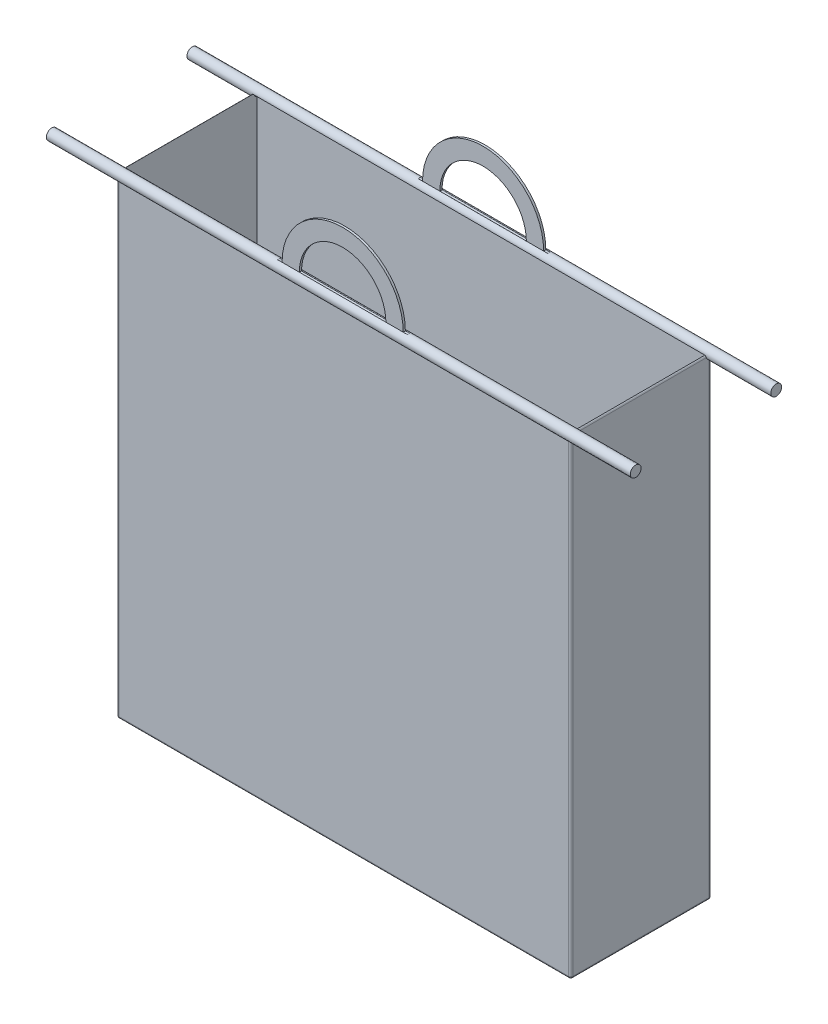
from build123d import *
from build123d.topology import SkipClean

# Parameters (mm, degrees)
SALIENTE_EXTRUIR3_DEPTH        = 342.9
SALIENTE_EXTRUIR3_DEPTH_BACK   = 342.9
CROQUIS3_R                     = 6.35
SALIENTE_EXTRUIR3_2_DEPTH      = 342.9
SALIENTE_EXTRUIR3_2_DEPTH_BACK = 342.9
CROQUIS4_W                     = 533.4
CROQUIS4_H                     = 165.1
SALIENTE_EXTRUIR4_DEPTH        = 555.498
VACIADO3_START                 = -265.43
VACIADO3_DEPTH                 = 530.86
VACIADO3_START_2               = -341.63
VACIADO3_2_OUTLINE_R           = 5.08
VACIADO3_2_DEPTH               = 683.26
REDONDEO5_R                    = 2.54
CROQUIS5_W                     = 152.4
CROQUIS5_H                     = 2.54
SALIENTE_EXTRUIR5_DEPTH        = 101.6
CORTAR_EXTRUIR2_DEPTH          = 676.270787465
CORTAR_EXTRUIR8_DEPTH          = 676.270787542


# Read off the part's stored shape, not the designer's step: Vaciado3
with BuildPart() as part:
    # Croquis3 → Saliente-Extruir3 (new, two sides: drawn at the far end of the back side and taken through both)
    with BuildSketch(Plane(origin=(0, 0, 0), x_dir=(0, 0, -1), z_dir=(1, 0, 0)).offset(-SALIENTE_EXTRUIR3_DEPTH_BACK)):
        Circle(CROQUIS3_R)
    extrude(amount=SALIENTE_EXTRUIR3_DEPTH + SALIENTE_EXTRUIR3_DEPTH_BACK)



with BuildPart() as body_2:
    # Croquis3 → Saliente-Extruir3 2 (new, two sides: drawn at the far end of the back side and taken through both)
    with BuildSketch(Plane(origin=(0, 0, 0), x_dir=(0, 0, -1), z_dir=(1, 0, 0)).offset(-SALIENTE_EXTRUIR3_2_DEPTH_BACK)):
        with Locations((165.1, 0)):
            Circle(CROQUIS3_R)
    extrude(amount=SALIENTE_EXTRUIR3_2_DEPTH + SALIENTE_EXTRUIR3_2_DEPTH_BACK)


with BuildPart() as part_1:
    add(part.part)

    add(body_2.part)  # Saliente-Extruir4 merges body 2
    # Croquis4 → Saliente-Extruir4 (add)
    with BuildSketch(Plane(origin=(0, 0, 0), x_dir=(1, 0, 0), z_dir=(0, 1, 0))):
        with Locations((0, 82.55)):
            Rectangle(CROQUIS4_W, CROQUIS4_H)
    extrude(amount=-SALIENTE_EXTRUIR4_DEPTH)

    # Vaciado3 outline → Vaciado3 (cut)
    with BuildSketch(Plane.YZ.offset(VACIADO3_START)):
        with BuildLine():
            Line((-554.228, -163.83), (-4.91868885, -163.83))
            ThreePointArc((-4.91868885, -163.83), (3.110851973, -169.116092628), (0, -160.02))
            Line((0, -160.02), (0, -5.08))
            ThreePointArc((0, -5.08), (3.110851973, 4.016092628), (-4.91868885, -1.27))
            Line((-4.91868885, -1.27), (-554.228, -1.27))
            Line((-554.228, -1.27), (-554.228, -163.83))
        make_face()
    extrude(amount=VACIADO3_DEPTH, mode=Mode.SUBTRACT)

    # Vaciado3 2 outline → Vaciado3 2 (cut)
    with BuildSketch(Plane.YZ.offset(VACIADO3_START_2)):
        with Locations((0, -165.1)):
            Circle(VACIADO3_2_OUTLINE_R)
        Circle(VACIADO3_2_OUTLINE_R)
    extrude(amount=VACIADO3_2_DEPTH, mode=Mode.SUBTRACT)

    # Redondeo5
    # the kernel refuses this fillet: 2.54 mm, written as the material it takes off along each edge
    with BuildSketch(Plane(origin=(-264.16, -552.958, -2.54), x_dir=(0, 0, 1), z_dir=(-1, 0, 0))) as redondeo5_piece_1_section:
        Polygon((0, 0), (REDONDEO5_R * 1.02, 0), (REDONDEO5_R * 1.02, -REDONDEO5_R * 1.02), (0, -REDONDEO5_R * 1.02), align=None)
    redondeo5_piece_1 = extrude(amount=REDONDEO5_R * 1.02, mode=Mode.PRIVATE)
    redondeo5_piece_1 = redondeo5_piece_1 - Plane(origin=(-264.16, -552.958, -2.54), x_dir=(0, 0.7071067811865475, -0.7071067811865475), z_dir=(-1, 0, 0)) * Sphere(REDONDEO5_R, mode=Mode.PRIVATE)
    add(redondeo5_piece_1, mode=Mode.SUBTRACT)
    with BuildSketch(Plane(origin=(-264.16, -552.958, -162.56), x_dir=(0, -1, 0), z_dir=(-1, 0, 0))) as redondeo5_piece_2_section:
        Polygon((0, 0), (REDONDEO5_R * 1.02, 0), (REDONDEO5_R * 1.02, -REDONDEO5_R * 1.02), (0, -REDONDEO5_R * 1.02), align=None)
    redondeo5_piece_2 = extrude(amount=REDONDEO5_R * 1.02, mode=Mode.PRIVATE)
    redondeo5_piece_2 = redondeo5_piece_2 - Plane(origin=(-264.16, -552.958, -162.56), x_dir=(0, 0.7071067811865475, 0.7071067811865475), z_dir=(-1, 0, 0)) * Sphere(REDONDEO5_R, mode=Mode.PRIVATE)
    add(redondeo5_piece_2, mode=Mode.SUBTRACT)
    with BuildSketch(Plane(origin=(264.16, -552.958, -2.54), x_dir=(1, 0, 0), z_dir=(0, 0, 1))) as redondeo5_piece_3_section:
        Polygon((0, 0), (REDONDEO5_R * 1.02, 0), (REDONDEO5_R * 1.02, -REDONDEO5_R * 1.02), (0, -REDONDEO5_R * 1.02), align=None)
    redondeo5_piece_3 = extrude(amount=REDONDEO5_R * 1.02, mode=Mode.PRIVATE)
    redondeo5_piece_3 = redondeo5_piece_3 - Plane(origin=(264.16, -552.958, -2.54), x_dir=(-0.7071067811865475, 0.7071067811865475, 0), z_dir=(0, 0, 1)) * Sphere(REDONDEO5_R, mode=Mode.PRIVATE)
    add(redondeo5_piece_3, mode=Mode.SUBTRACT)
    with BuildSketch(Plane(origin=(264.16, -552.958, -162.56), x_dir=(1, 0, 0), z_dir=(0, -1, 0))) as redondeo5_piece_4_section:
        Polygon((0, 0), (REDONDEO5_R * 1.02, 0), (REDONDEO5_R * 1.02, -REDONDEO5_R * 1.02), (0, -REDONDEO5_R * 1.02), align=None)
    redondeo5_piece_4 = extrude(amount=REDONDEO5_R * 1.02, mode=Mode.PRIVATE)
    redondeo5_piece_4 = redondeo5_piece_4 - Plane(origin=(264.16, -552.958, -162.56), x_dir=(-0.7071067811865474, 0, 0.7071067811865477), z_dir=(0, -1, 0)) * Sphere(REDONDEO5_R, mode=Mode.PRIVATE)
    add(redondeo5_piece_4, mode=Mode.SUBTRACT)
    with BuildSketch(Plane(origin=(266.7, 0, -164.249261314), x_dir=(0, -1, 0), z_dir=(0, 0, 1))) as redondeo5_piece_5_section:
        with BuildLine():
            CenterArc((2.199704526, -2.54), REDONDEO5_R, 90, 60)
            Line((0, -1.27), (0, 0))
            Line((0, 0), (2.199704526, 0))
        make_face()
    redondeo5_piece_5 = extrude(amount=163.398522628, mode=Mode.PRIVATE)
    redondeo5_piece_5 = redondeo5_piece_5 - Plane(origin=(266.364103935, 0, 0), x_dir=(0, 0, -1), z_dir=(-1, 0, 0)) * Cylinder(6.35, 336, mode=Mode.PRIVATE)
    redondeo5_piece_5 = redondeo5_piece_5 - Plane(origin=(266.364103935, 0, -165.1), x_dir=(0, 0, -1), z_dir=(-1, 0, 0)) * Cylinder(6.35, 336, mode=Mode.PRIVATE)
    add(redondeo5_piece_5, mode=Mode.SUBTRACT)
    with BuildSketch(Plane(origin=(-266.7, 0, -0.850738686), x_dir=(1, 0, 0), z_dir=(0, 0, -1))) as redondeo5_piece_6_section:
        with BuildLine():
            CenterArc((2.54, 2.199704526), REDONDEO5_R, 180, 60)
            Line((0, 2.199704526), (0, 0))
            Line((0, 0), (1.27, 0))
        make_face()
    redondeo5_piece_6 = extrude(amount=163.398522628, mode=Mode.PRIVATE)
    redondeo5_piece_6 = redondeo5_piece_6 - Plane(origin=(-266.364103935, 0, 0), x_dir=(0, 0, -1), z_dir=(-1, 0, 0)) * Cylinder(6.35, 336, mode=Mode.PRIVATE)
    redondeo5_piece_6 = redondeo5_piece_6 - Plane(origin=(-266.364103935, 0, -165.1), x_dir=(0, 0, -1), z_dir=(-1, 0, 0)) * Cylinder(6.35, 336, mode=Mode.PRIVATE)
    add(redondeo5_piece_6, mode=Mode.SUBTRACT)
    with BuildSketch(Plane(origin=(-266.7, 0, 0), x_dir=(1, 0, 0), z_dir=(0, -1, 0))) as redondeo5_piece_7_section:
        with BuildLine():
            CenterArc((REDONDEO5_R, -REDONDEO5_R), REDONDEO5_R, 90, 90)
            Line((0, -REDONDEO5_R), (0, 0))
            Line((0, 0), (REDONDEO5_R, 0))
        make_face()
    redondeo5_piece_7 = extrude(amount=552.958, mode=Mode.PRIVATE)
    redondeo5_piece_7 = redondeo5_piece_7 - Plane(origin=(-266.132673367, 0, 0), x_dir=(0, 0, -1), z_dir=(-1, 0, 0)) * Cylinder(6.35, 1117, mode=Mode.PRIVATE)
    add(redondeo5_piece_7, mode=Mode.SUBTRACT)
    with BuildSketch(Plane(origin=(-266.7, -555.498, -2.54), x_dir=(0, 1, 0), z_dir=(0, 0, -1)), Plane(origin=(266.7, -555.498, -162.56), x_dir=(0, 1, 0), z_dir=(0, 0, 1))) as redondeo5_piece_8:
        with BuildLine():
            CenterArc((REDONDEO5_R, REDONDEO5_R), REDONDEO5_R, 180, 90)
            Line((0, REDONDEO5_R), (0, 0))
            Line((0, 0), (REDONDEO5_R, 0))
        make_face()
    extrude(amount=160.02, mode=Mode.SUBTRACT)
    with BuildSketch(Plane(origin=(-266.7, 0, -165.1), x_dir=(0, 0, 1), z_dir=(0, -1, 0))) as redondeo5_piece_9_section:
        with BuildLine():
            CenterArc((REDONDEO5_R, -REDONDEO5_R), REDONDEO5_R, 90, 90)
            Line((0, -REDONDEO5_R), (0, 0))
            Line((0, 0), (REDONDEO5_R, 0))
        make_face()
    redondeo5_piece_9 = extrude(amount=552.958, mode=Mode.PRIVATE)
    redondeo5_piece_9 = redondeo5_piece_9 - Plane(origin=(-266.132672665, 0, -165.1), x_dir=(0, 0, -1), z_dir=(-1, 0, 0)) * Cylinder(6.35, 1117, mode=Mode.PRIVATE)
    add(redondeo5_piece_9, mode=Mode.SUBTRACT)
    with BuildSketch(Plane(origin=(266.7, 0, 0), x_dir=(-1, 0, 0), z_dir=(0, -1, 0))) as redondeo5_piece_10_section:
        with BuildLine():
            CenterArc((REDONDEO5_R, REDONDEO5_R), REDONDEO5_R, 180, 90)
            Line((0, REDONDEO5_R), (0, 0))
            Line((0, 0), (REDONDEO5_R, 0))
        make_face()
    redondeo5_piece_10 = extrude(amount=552.958, mode=Mode.PRIVATE)
    redondeo5_piece_10 = redondeo5_piece_10 - Plane(origin=(266.132673367, 0, 0), x_dir=(0, 0, -1), z_dir=(-1, 0, 0)) * Cylinder(6.35, 1117, mode=Mode.PRIVATE)
    add(redondeo5_piece_10, mode=Mode.SUBTRACT)
    with BuildSketch(Plane(origin=(264.16, -555.498, 0), x_dir=(0, 1, 0), z_dir=(-1, 0, 0))) as redondeo5_piece_11:
        with BuildLine():
            CenterArc((REDONDEO5_R, REDONDEO5_R), REDONDEO5_R, 180, 90)
            Line((0, REDONDEO5_R), (0, 0))
            Line((0, 0), (REDONDEO5_R, 0))
        make_face()
    extrude(amount=528.32, mode=Mode.SUBTRACT)
    with BuildSketch(Plane(origin=(-264.16, -555.498, -165.1), x_dir=(0, 0, 1), z_dir=(1, 0, 0))) as redondeo5_piece_12:
        with BuildLine():
            CenterArc((REDONDEO5_R, -REDONDEO5_R), REDONDEO5_R, 90, 90)
            Line((0, -REDONDEO5_R), (0, 0))
            Line((0, 0), (REDONDEO5_R, 0))
        make_face()
    extrude(amount=528.32, mode=Mode.SUBTRACT)
    with BuildSketch(Plane(origin=(266.7, 0, -165.1), x_dir=(0, 0, 1), z_dir=(0, -1, 0))) as redondeo5_piece_13_section:
        with BuildLine():
            CenterArc((REDONDEO5_R, REDONDEO5_R), REDONDEO5_R, 180, 90)
            Line((0, REDONDEO5_R), (0, 0))
            Line((0, 0), (REDONDEO5_R, 0))
        make_face()
    redondeo5_piece_13 = extrude(amount=552.958, mode=Mode.PRIVATE)
    redondeo5_piece_13 = redondeo5_piece_13 - Plane(origin=(266.132672665, 0, -165.1), x_dir=(0, 0, -1), z_dir=(-1, 0, 0)) * Cylinder(6.35, 1117, mode=Mode.PRIVATE)
    add(redondeo5_piece_13, mode=Mode.SUBTRACT)

    # Croquis5 → Saliente-Extruir5 (add)
    with SkipClean():  # the faces are left unmerged after this step: merging them gives an invalid solid
        with BuildSketch(Plane(origin=(0, 0, 0), x_dir=(1, 0, 0), z_dir=(0, 1, 0))):
            with Locations((0, 164.974335694)):
                Rectangle(CROQUIS5_W, CROQUIS5_H)
            Rectangle(CROQUIS5_W, CROQUIS5_H)
        extrude(amount=SALIENTE_EXTRUIR5_DEPTH)

    # Croquis6 → Cortar-Extruir2 (cut, through all)
    with SkipClean():  # the faces are left unmerged after this step: merging them gives an invalid solid
        with BuildSketch(Plane.XY.offset(1.27)):
            with BuildLine():
                Line((-50.8, 6.221703947), (50.8, 6.221703947))
                ThreePointArc((50.8, 6.221703947), (0, 57.021703947), (-50.8, 6.221703947))
            make_face()
        extrude(amount=-CORTAR_EXTRUIR2_DEPTH, mode=Mode.SUBTRACT)

    # Croquis7 → Cortar-Extruir8 (cut, through all)
    with SkipClean():  # the faces are left unmerged after this step: merging them gives an invalid solid
        with BuildSketch(Plane.XY.offset(1.27)):
            with BuildLine():
                Line((-71.12, 6.221703947), (-76.2, 6.221703947))
                Line((-76.2, 6.221703947), (-76.2, 101.6))
                Line((-76.2, 101.6), (76.2, 101.6))
                Line((76.2, 101.6), (76.2, 6.221703947))
                Line((76.2, 6.221703947), (71.12, 6.221703947))
                ThreePointArc((71.12, 6.221703947), (0, 77.341703947), (-71.12, 6.221703947))
            make_face()
        extrude(amount=-CORTAR_EXTRUIR8_DEPTH, mode=Mode.SUBTRACT)


solid = part_1.part
